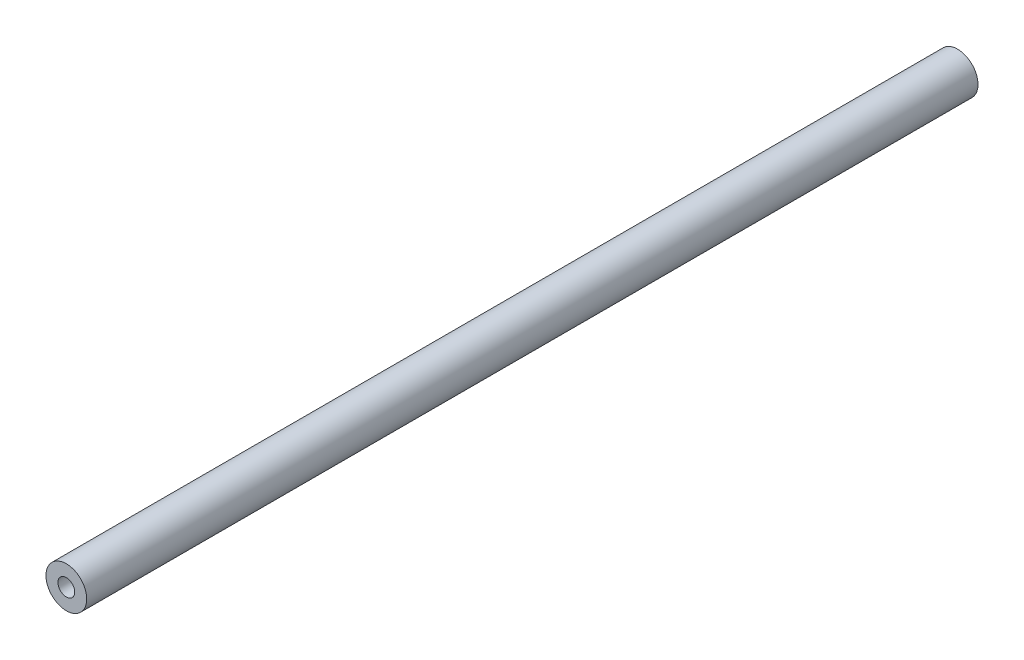
from build123d import *

# Parameters (mm, degrees)
SKETCH_1_R      = 4
SKETCH_1_R_2    = 2
EXTRUDE_1_DEPTH = 87.5


# Read off the part's stored shape, not the designer's step: M4x0.7 ねじ穴1
with BuildPart() as part:
    # ｽｹｯﾁ1 → ﾎﾞｽ - 押し出し1 (new, symmetric)
    # profile 1 of 2: a face of its own
    with BuildSketch(Plane.XY):
        Circle(SKETCH_1_R)
        Circle(SKETCH_1_R_2, mode=Mode.SUBTRACT)
    # profile 2 of 2: a face of its own
    with BuildSketch(Plane.XY):
        Circle(SKETCH_1_R_2)
    extrude(amount=EXTRUDE_1_DEPTH, both=True)

    # M4x0.7 ねじ穴1 outline → M4x0.7 ねじ穴1 (revolve, cut)
    with BuildSketch(Plane.XZ):
        Polygon((1.65, -76), (0, -75.008579979), (0, -87.5), (1.65, -87.5), align=None)
        Polygon((0, 87.5), (0, 75.008579979), (1.65, 76), (1.65, 87.5), align=None)
    revolve(axis=Axis((0, 0, 0), (0, 0, 1)), mode=Mode.SUBTRACT)


solid = part.part
